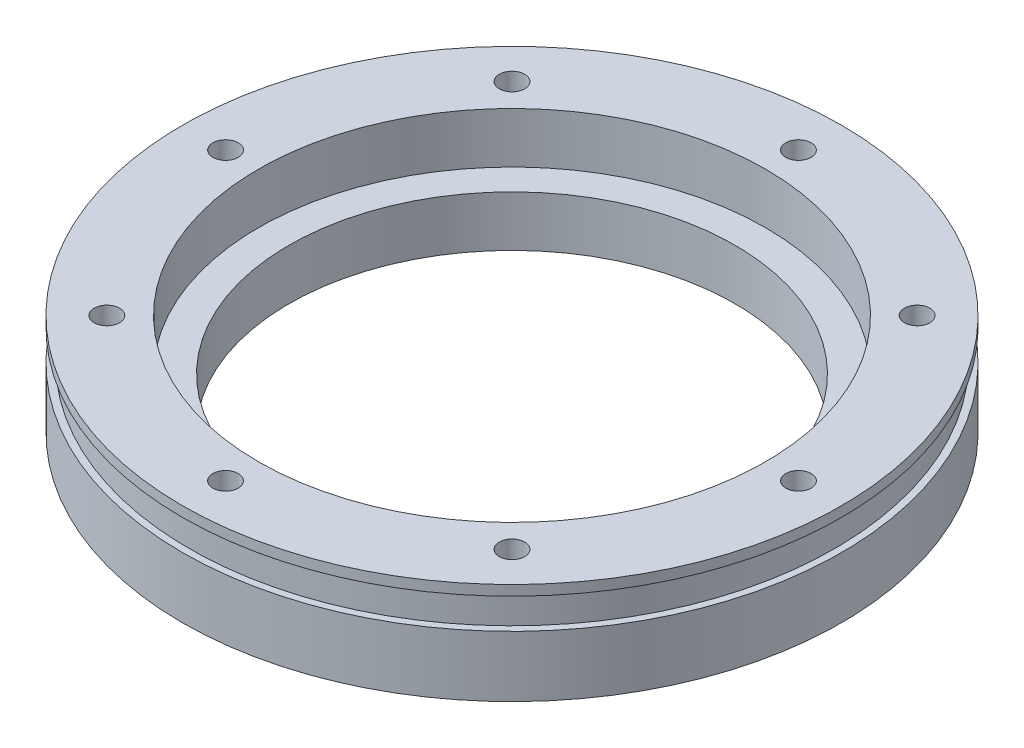
from build123d import *

# Parameters (mm, degrees)
SKETCH1_R                = 63.66
BOSS_EXTRUDE1_DEPTH      = 10
SKETCH2_R                = 65
BOSS_EXTRUDE2_DEPTH      = 2
BOSS_EXTRUDE3_DEPTH      = 10
BOSS_EXTRUDE3_DEPTH_BACK = 2
SKETCH3_R                = 65
SKETCH4_R                = 2.5
SKETCH4_R_2              = 44
CUT_EXTRUDE1_DEPTH       = 95.074438611
SKETCH5_R                = 50
CUT_EXTRUDE2_DEPTH       = 10


with BuildPart() as part:
    # Sketch1 → Boss-Extrude1 (new body)
    with BuildSketch(Plane(origin=(0, 0, 0), x_dir=(1, 0, 0), z_dir=(0, 1, 0))):
        Circle(SKETCH1_R)
    extrude(amount=BOSS_EXTRUDE1_DEPTH)

    # Sketch2 → Boss-Extrude2 (add)
    with BuildSketch(Plane(origin=(0, 10, 0), x_dir=(1, 0, 0), z_dir=(0, 1, 0))):
        Circle(SKETCH2_R)
    extrude(amount=-BOSS_EXTRUDE2_DEPTH)

    # Sketch3 → Boss-Extrude3 (add, two sides: drawn at the far end of the back side and taken through both)
    with BuildSketch(Plane.XZ.offset(-BOSS_EXTRUDE3_DEPTH_BACK)):
        Circle(SKETCH3_R)
    extrude(amount=BOSS_EXTRUDE3_DEPTH + BOSS_EXTRUDE3_DEPTH_BACK)

    # Sketch4 → Cut-Extrude1 (cut, through all)
    with BuildSketch(Plane(origin=(0, 10, 0), x_dir=(1, 0, 0), z_dir=(0, 1, 0))):
        with Locations((0, 56.5)):
            Circle(SKETCH4_R)
        with Locations((39.951533137, 39.951533137)):
            Circle(SKETCH4_R)
        with Locations((56.5, 0)):
            Circle(SKETCH4_R)
        with Locations((39.951533137, -39.951533137)):
            Circle(SKETCH4_R)
        with Locations((0, -56.5)):
            Circle(SKETCH4_R)
        with Locations((-39.951533137, -39.951533137)):
            Circle(SKETCH4_R)
        with Locations((-56.5, 0)):
            Circle(SKETCH4_R)
        with Locations((-39.951533137, 39.951533137)):
            Circle(SKETCH4_R)
        Circle(SKETCH4_R_2)
    extrude(amount=-CUT_EXTRUDE1_DEPTH, mode=Mode.SUBTRACT)

    # Sketch5 → Cut-Extrude2 (cut)
    with BuildSketch(Plane(origin=(0, 10, 0), x_dir=(1, 0, 0), z_dir=(0, 1, 0))):
        Circle(SKETCH5_R)
    extrude(amount=-CUT_EXTRUDE2_DEPTH, mode=Mode.SUBTRACT)


solid = part.part
